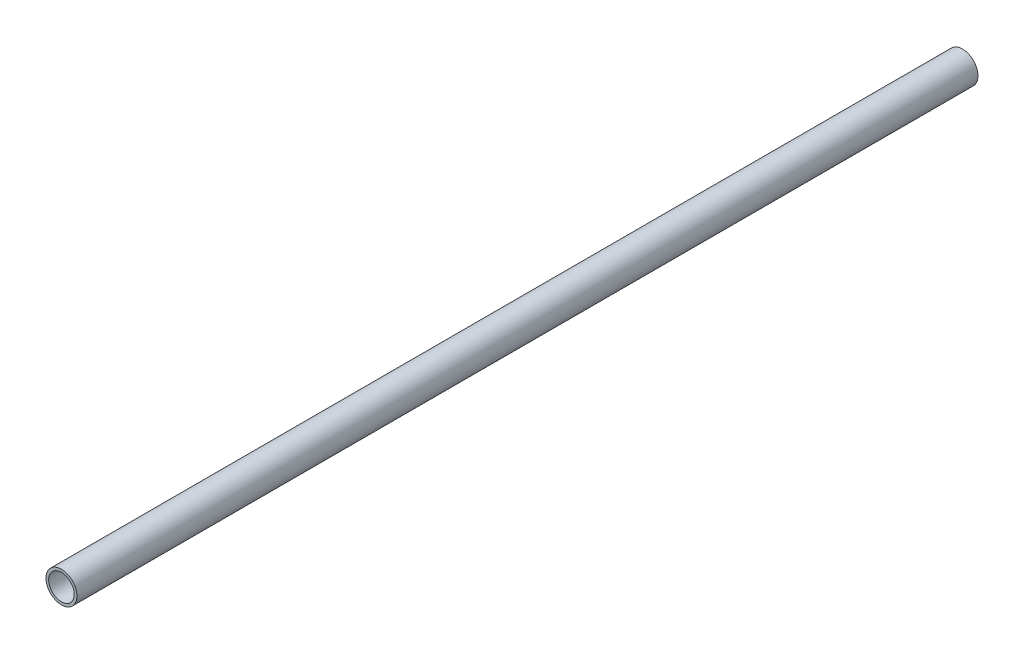
from build123d import *

# Parameters (mm, degrees)
SKETCH1_R           = 17.4625
SKETCH1_R_2         = 14.4145
BOSS_EXTRUDE1_DEPTH = 508


with BuildPart() as part:
    # Sketch1 → Boss-Extrude1 (new, symmetric)
    with BuildSketch(Plane(origin=(0, 0, 0), x_dir=(0, 1, 0), z_dir=(0, 0, 1))):
        Circle(SKETCH1_R)
        Circle(SKETCH1_R_2, mode=Mode.SUBTRACT)
    extrude(amount=BOSS_EXTRUDE1_DEPTH, both=True)


solid = part.part
